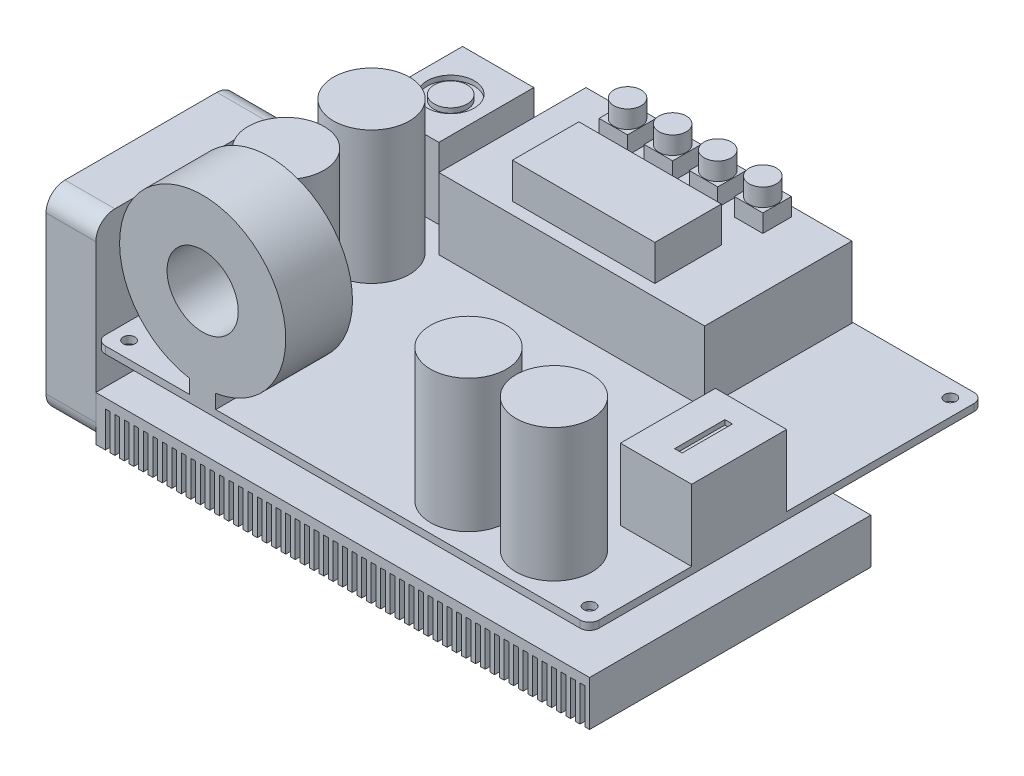
from build123d import *

# Parameters (mm, degrees)
BOSS_EXTRUDE1_DEPTH      = 0.75
BOSS_EXTRUDE1_DEPTH_BACK = 0.75
SKETCH1_W                = 104
SKETCH1_H                = 83
SKETCH2_R                = 1.25
CUT_EXTRUDE1_DEPTH       = 67.546975889
MIRROR2_COPY_1_SKETCH_R  = 1.25
MIRROR2_COPY_1_DEPTH     = 67.546975889
FILLET1_R                = 2
FILLET2_R                = 2
FILLET3_R                = 2
FILLET4_R                = 2
BOSS_EXTRUDE2_DEPTH      = 9.5
SKETCH7_W                = 1
SKETCH7_H                = 59.25
CUT_EXTRUDE2_DEPTH       = 7.5
LPATTERN1_COUNT          = 51
LPATTERN1_PITCH          = 2
SKETCH8_W                = 15
SKETCH8_H                = 20
BOSS_EXTRUDE3_DEPTH      = 15
SKETCH9_W                = 1.581908336
SKETCH9_H                = 5.303824111
CUT_EXTRUDE3_DEPTH       = 1
CUT_EXTRUDE4_DEPTH       = 1
SKETCH12_W               = 35
SKETCH12_H               = 14.062260348
BOSS_EXTRUDE4_DEPTH      = 38
BOSS_EXTRUDE5_DEPTH      = 22
BOSS_EXTRUDE5_DEPTH_BACK = 19
FILLET5_R                = 4
FILLET6_R                = 4
FILLET7_R                = 4
FILLET8_R                = 4
SKETCH14_R               = 8
BOSS_EXTRUDE6_DEPTH      = 28
CUT_EXTRUDE6_START       = -14.062260348
CUT_EXTRUDE6_OUTLINE_R   = 7.5
CUT_EXTRUDE6_DEPTH       = 14.062260348
BOSS_EXTRUDE7_REACH      = 84.368
SKETCH18_W               = 56
SKETCH18_H               = 31
SKETCH19_W               = 6
SKETCH19_H               = 6
BOSS_EXTRUDE8_DEPTH      = 3.75
SKETCH20_R               = 2.875
BOSS_EXTRUDE9_DEPTH      = 3.75
LPATTERN2_COUNT          = 2
LPATTERN2_PITCH          = 9.5
LPATTERN2_COL_COUNT      = 3
LPATTERN2_COL_PITCH      = 9.5
BOSS_EXTRUDE10_DEPTH     = 7.5


# Read off the part's stored shape, not the designer's step: Cut-Extrude6
with BuildPart() as part:
    # Sketch1 → Boss-Extrude1 (new, two sides: drawn at the far end of the back side and taken through both)
    with BuildSketch(Plane(origin=(0, 0, 0), x_dir=(1, 0, 0), z_dir=(0, 1, 0)).offset(-BOSS_EXTRUDE1_DEPTH_BACK)):
        Rectangle(SKETCH1_W, SKETCH1_H)
    extrude(amount=BOSS_EXTRUDE1_DEPTH + BOSS_EXTRUDE1_DEPTH_BACK)

    # Sketch2 → Cut-Extrude1 (cut, through all)
    with BuildSketch(Plane(origin=(0, 0.75, 0), x_dir=(1, 0, 0), z_dir=(0, 1, 0))):
        with Locations(Location((48.5, -38, 0), (0, 0, 270))):
            Circle(SKETCH2_R)
    cut_extrude1 = extrude(amount=-CUT_EXTRUDE1_DEPTH, mode=Mode.SUBTRACT)

    # Mirror1: Cut-Extrude1 across plane
    add(cut_extrude1.mirror(Plane(origin=(0, 0, 0), x_dir=(0, 0, 1), z_dir=(1, 0, 0))), mode=Mode.SUBTRACT)

    # Mirror2: Cut-Extrude1 across plane
    add(cut_extrude1.mirror(Plane.XY), mode=Mode.SUBTRACT)

    # Mirror2 copy 1 sketch → Mirror2 copy 1 (cut, through all)
    with BuildSketch(Plane(origin=(0, 0.75, 0), x_dir=(-1, 0, 0), z_dir=(0, 1, 0))):
        with Locations(Location((48.5, -38, 0), (0, 0, 270))):
            Circle(MIRROR2_COPY_1_SKETCH_R)
    extrude(amount=-MIRROR2_COPY_1_DEPTH, mode=Mode.SUBTRACT)

    # Fillet1
    fillet1_edges = [part.edges().sort_by_distance(p)[0] for p in [
        (52, 0, 41.5),
    ]]
    fillet(fillet1_edges, radius=FILLET1_R)

    # Fillet2
    fillet2_edges = [part.edges().sort_by_distance(p)[0] for p in [
        (-52, 0, 41.5),
    ]]
    fillet(fillet2_edges, radius=FILLET2_R)

    # Fillet3
    fillet3_edges = [part.edges().sort_by_distance(p)[0] for p in [
        (-52, 0, -41.5),
    ]]
    fillet(fillet3_edges, radius=FILLET3_R)

    # Fillet4
    fillet4_edges = [part.edges().sort_by_distance(p)[0] for p in [
        (52, 0, -41.5),
    ]]
    fillet(fillet4_edges, radius=FILLET4_R)

    # Sketch8 → Boss-Extrude3 (add)
    with BuildSketch(Plane(origin=(0, 0.75, 0), x_dir=(1, 0, 0), z_dir=(0, 1, 0))):
        with Locations((44.5, -10)):
            Rectangle(SKETCH8_W, SKETCH8_H)
        Polygon((-37, 35.75), (-48.5, 35.75), (-52, 35.75), (-52, 15.75), (-37, 15.75), align=None)
    extrude(amount=BOSS_EXTRUDE3_DEPTH)

    # Sketch9 → Cut-Extrude3 (cut)
    with BuildSketch(Plane(origin=(0, 15.75, 0), x_dir=(1, 0, 0), z_dir=(0, 1, 0))):
        with Locations((44.5, -12.651912056)):
            Rectangle(SKETCH9_W, SKETCH9_H)
        with Locations((44.5, -7.348087944)):
            Rectangle(SKETCH9_W, SKETCH9_H)
    extrude(amount=-CUT_EXTRUDE3_DEPTH, mode=Mode.SUBTRACT)

    # Sketch10 → Cut-Extrude4 (cut)
    with BuildSketch(Plane(origin=(0, 15.75, 0), x_dir=(1, 0, 0), z_dir=(0, 1, 0))):
        with BuildLine():
            ThreePointArc((-49.474453344, 25.75), (-44.5, 20.775546656), (-39.525546656, 25.75))
            Line((-39.525546656, 25.75), (-41.021566764, 25.75))
            ThreePointArc((-41.021566764, 25.75), (-44.5, 22.271566764), (-47.978433236, 25.75))
            Line((-47.978433236, 25.75), (-49.474453344, 25.75))
        make_face()
        with BuildLine():
            Line((-41.021566764, 25.75), (-39.525546656, 25.75))
            ThreePointArc((-39.525546656, 25.75), (-44.5, 30.724453344), (-49.474453344, 25.75))
            Line((-49.474453344, 25.75), (-47.978433236, 25.75))
            ThreePointArc((-47.978433236, 25.75), (-44.5, 29.228433236), (-41.021566764, 25.75))
        make_face()
    extrude(amount=-CUT_EXTRUDE4_DEPTH, mode=Mode.SUBTRACT)

    # Sketch12 → Boss-Extrude4 (add)
    with BuildSketch(Plane(origin=(0, 0.75, 0), x_dir=(1, 0, 0), z_dir=(0, 1, 0))):
        with Locations((-29.5, -34.468869826)):
            Rectangle(SKETCH12_W, SKETCH12_H)
    extrude(amount=BOSS_EXTRUDE4_DEPTH)

    # Sketch14 → Boss-Extrude6 (add)
    with BuildSketch(Plane(origin=(0, 0.75, 0), x_dir=(1, 0, 0), z_dir=(0, 1, 0))):
        with Locations(Location((-39, 3.562260348, 0), (0, 0, 270))):
            Circle(SKETCH14_R)
        with Locations(Location((-39, -14.437739652, 0), (0, 0, 270))):
            Circle(SKETCH14_R)
        with Locations(Location((34.5, -31.5, 0), (0, 0, 270))):
            Circle(SKETCH14_R)
        with Locations(Location((16.5, -31.5, 0), (0, 0, 270))):
            Circle(SKETCH14_R)
    extrude(amount=BOSS_EXTRUDE6_DEPTH)

    # Cut-Extrude6 outline → Cut-Extrude6 (cut)
    with BuildSketch(Plane.XY.offset(41.5).offset(CUT_EXTRUDE6_START)):
        with BuildLine():
            Line((-26.75, 0.75), (-12, 0.75))
            Line((-12, 0.75), (-12, 21))
            ThreePointArc((-12, 21), (-16.188820488, 9.639432232), (-26.75, 3.717422067))
            Line((-26.75, 3.717422067), (-26.75, 0.75))
        make_face()
        with BuildLine():
            ThreePointArc((-47, 20.999999999), (-29.5, 38.5), (-12, 21))
            Line((-12, 21), (-12, 38.75))
            Line((-12, 38.75), (-47, 38.75))
            Line((-47, 38.75), (-47, 20.999999999))
        make_face()
        with BuildLine():
            Line((-47, 0.75), (-32.25, 0.75))
            Line((-32.25, 0.75), (-32.25, 3.717422067))
            ThreePointArc((-32.25, 3.717422067), (-42.811179512, 9.639432232), (-47, 20.999999999))
            Line((-47, 20.999999999), (-47, 0.75))
        make_face()
        with Locations((-29.5, 21)):
            Circle(CUT_EXTRUDE6_OUTLINE_R)
    extrude(amount=CUT_EXTRUDE6_DEPTH, mode=Mode.SUBTRACT)

    # Sketch18 → Boss-Extrude7 (add, up to next)
    with BuildSketch(Plane(origin=(0, 15.75, 0), x_dir=(1, 0, 0), z_dir=(0, 1, 0)), mode=Mode.PRIVATE) as boss_extrude7_sk1:
        with Locations((-3.5, 25.75)):
            Rectangle(SKETCH18_W, SKETCH18_H)
    boss_extrude7_tool1 = extrude(boss_extrude7_sk1.sketch, amount=-BOSS_EXTRUDE7_REACH, mode=Mode.PRIVATE) - part.part
    add(boss_extrude7_tool1.solids().sort_by_distance((-3.5, 15.75, -25.75))[0])

    # Sketch19 → Boss-Extrude8 (add)
    with BuildSketch(Plane(origin=(0, 15.75, 0), x_dir=(1, 0, 0), z_dir=(0, 1, 0))):
        with Locations((-8.25, 36.25)):
            Rectangle(SKETCH19_W, SKETCH19_H)
    boss_extrude8 = extrude(amount=BOSS_EXTRUDE8_DEPTH)

    # Sketch20 → Boss-Extrude9 (add)
    with BuildSketch(Plane(origin=(0, 19.5, 0), x_dir=(1, 0, 0), z_dir=(0, 1, 0))):
        with Locations(Location((-8.25, 36.25, 0), (0, 0, 270))):
            Circle(SKETCH20_R)
    boss_extrude9 = extrude(amount=BOSS_EXTRUDE9_DEPTH)

    # LPattern2: Boss-Extrude8, Boss-Extrude9 ×2
    with Locations(*[(-i * LPATTERN2_PITCH, 0, 0) for i in range(1, LPATTERN2_COUNT)]):
        add(boss_extrude8)
        add(boss_extrude9)

    # LPattern2 col: Boss-Extrude8, Boss-Extrude9 ×3
    with Locations(*[(i * LPATTERN2_COL_PITCH, 0, 0) for i in range(1, LPATTERN2_COL_COUNT)]):
        add(boss_extrude8)
        add(boss_extrude9)

    # Sketch21 → Boss-Extrude10 (add)
    with BuildSketch(Plane(origin=(0, 15.75, 0), x_dir=(1, 0, 0), z_dir=(0, 1, 0))):
        Polygon((-18.5, 12.75), (-3.5, 12.75), (-3.5, 19.75), (-3.5, 26.75), (-18.5, 26.75), align=None)
        Polygon((-3.5, 19.75), (-3.5, 12.75), (11.5, 12.75), (11.5, 26.75), (-3.5, 26.75), align=None)
    extrude(amount=BOSS_EXTRUDE10_DEPTH)


with BuildPart() as body_2:
    # Sketch5 → Boss-Extrude2 (new body)
    with BuildSketch(Plane(origin=(0, -8.75, 0), x_dir=(-1, 0, 0), z_dir=(0, -1, 0))):
        Polygon((0, 17.75), (-52, 17.75), (-52, -41.5), (0, -41.5), (0, 0), align=None)
    boss_extrude2 = extrude(amount=BOSS_EXTRUDE2_DEPTH)

    # Mirror7: Boss-Extrude2 across plane
    add(boss_extrude2.mirror(Plane(origin=(0, 0, 0), x_dir=(0, 0, 1), z_dir=(1, 0, 0))))

    # Sketch7 → Cut-Extrude2 (cut)
    with BuildSketch(Plane(origin=(0, -18.25, 0), x_dir=(-1, 0, 0), z_dir=(0, -1, 0))):
        with Locations((-50.5, -11.875)):
            Rectangle(SKETCH7_W, SKETCH7_H)
    cut_extrude2 = extrude(amount=-CUT_EXTRUDE2_DEPTH, mode=Mode.SUBTRACT)

    # LPattern1: Cut-Extrude2 ×51
    with Locations(*[(-i * LPATTERN1_PITCH, 0, 0) for i in range(1, LPATTERN1_COUNT)]):
        add(cut_extrude2, mode=Mode.SUBTRACT)


with BuildPart() as body_3:
    # Sketch13 → Boss-Extrude5 (new, two sides: drawn at the far end of the back side and taken through both)
    with BuildSketch(Plane(origin=(0, 0.75, 0), x_dir=(1, 0, 0), z_dir=(0, 1, 0)).offset(-BOSS_EXTRUDE5_DEPTH_BACK)):
        Polygon((-52, -39.5), (-52, -1.5), (-62.5, -1.5), (-62.5, -41.5), (-52, -41.5), align=None)
    extrude(amount=BOSS_EXTRUDE5_DEPTH + BOSS_EXTRUDE5_DEPTH_BACK)

    # Fillet5
    fillet5_edges = [body_3.edges().sort_by_distance(p)[0] for p in [
        (-57.25, 22.75, 41.5),
    ]]
    fillet(fillet5_edges, radius=FILLET5_R)

    # Fillet6
    fillet6_edges = [body_3.edges().sort_by_distance(p)[0] for p in [
        (-57.25, 22.75, 1.5),
    ]]
    fillet(fillet6_edges, radius=FILLET6_R)

    # Fillet7
    fillet7_edges = [body_3.edges().sort_by_distance(p)[0] for p in [
        (-57.25, -18.25, 41.5),
    ]]
    fillet(fillet7_edges, radius=FILLET7_R)

    # Fillet8
    fillet8_edges = [body_3.edges().sort_by_distance(p)[0] for p in [
        (-57.25, -18.25, 1.5),
    ]]
    fillet(fillet8_edges, radius=FILLET8_R)


solid = Compound([part.part, body_2.part, body_3.part])
